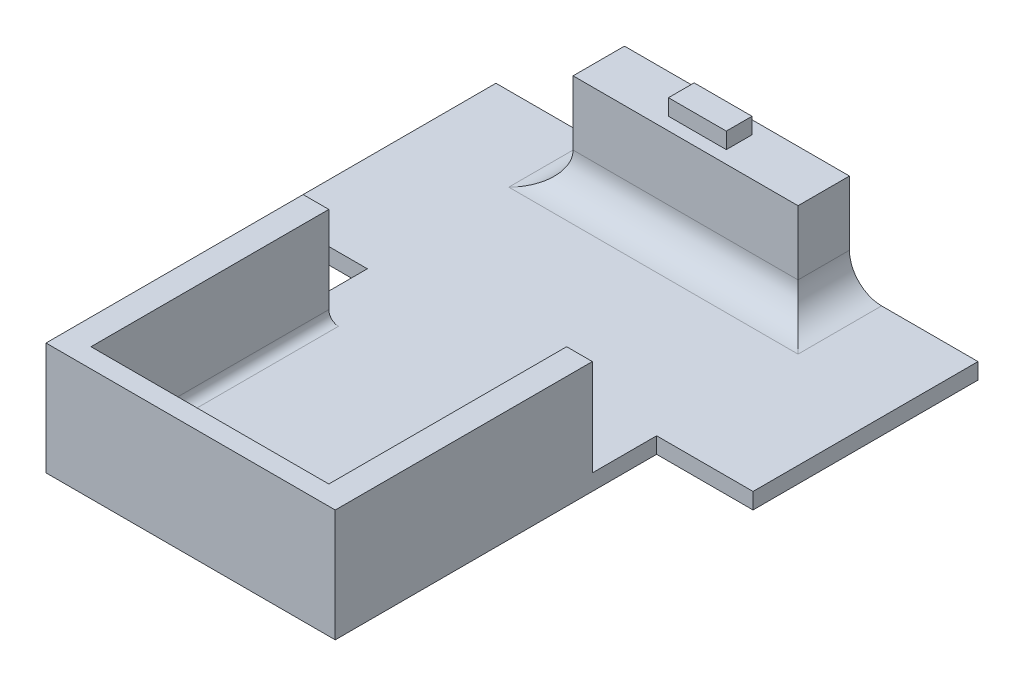
from build123d import *

# Parameters (mm, degrees)
SKETCH1_R           = 2.5
BOSS_EXTRUDE1_DEPTH = 5
SKETCH2_W           = 70
SKETCH2_H           = 16
BOSS_EXTRUDE2_DEPTH = 30
FILLET1_R           = 10
FILLET2_R           = 3
SKETCH9_W           = 18
SKETCH9_H           = 8
BOSS_EXTRUDE9_DEPTH = 5


with BuildPart() as part:
    # Sketch1 → Boss-Extrude1 (new body)
    with BuildSketch(Plane(origin=(0, 0, 0), x_dir=(1, 0, 0), z_dir=(0, 1, 0))):
        Polygon((-45, -85), (45, -85), (45, 15), (75, 15), (75, 85), (-75, 85), (-75, 15), (-45, 15), align=None)
        with Locations((-8.5, -60.45079013)):
            Circle(SKETCH1_R, mode=Mode.SUBTRACT)
        with Locations((8.5, -60.45079013)):
            Circle(SKETCH1_R, mode=Mode.SUBTRACT)
    extrude(amount=BOSS_EXTRUDE1_DEPTH)

    # Sketch2 → Boss-Extrude2 (add)
    with BuildSketch(Plane(origin=(0, 5, 0), x_dir=(1, 0, 0), z_dir=(0, 1, 0))):
        with Locations((0, 77)):
            Rectangle(SKETCH2_W, SKETCH2_H)
        Polygon((-45, -85), (45, -85), (45, -5), (37, -5), (37, -79), (-37, -79), (-37, -5), (-45, -5), align=None)
    extrude(amount=BOSS_EXTRUDE2_DEPTH)

    # Fillet1
    fillet1_edges = [part.edges().sort_by_distance(p)[0] for p in [
        (0, 5, -69),
        (35, 5, -77),
        (-35, 5, -77),
    ]]
    fillet(fillet1_edges, radius=FILLET1_R)

    # Fillet2
    fillet2_edges = [part.edges().sort_by_distance(p)[0] for p in [
        (0, 5, 79),
        (-37, 5, 42),
        (37, 5, 42),
    ]]
    fillet(fillet2_edges, radius=FILLET2_R)

    # Sketch9 → Boss-Extrude9 (add)
    with BuildSketch(Plane(origin=(0, 35, 0), x_dir=(1, 0, 0), z_dir=(0, 1, 0))):
        with Locations((-0.264957407, 76.945272118)):
            Rectangle(SKETCH9_W, SKETCH9_H)
    extrude(amount=BOSS_EXTRUDE9_DEPTH)


solid = part.part
